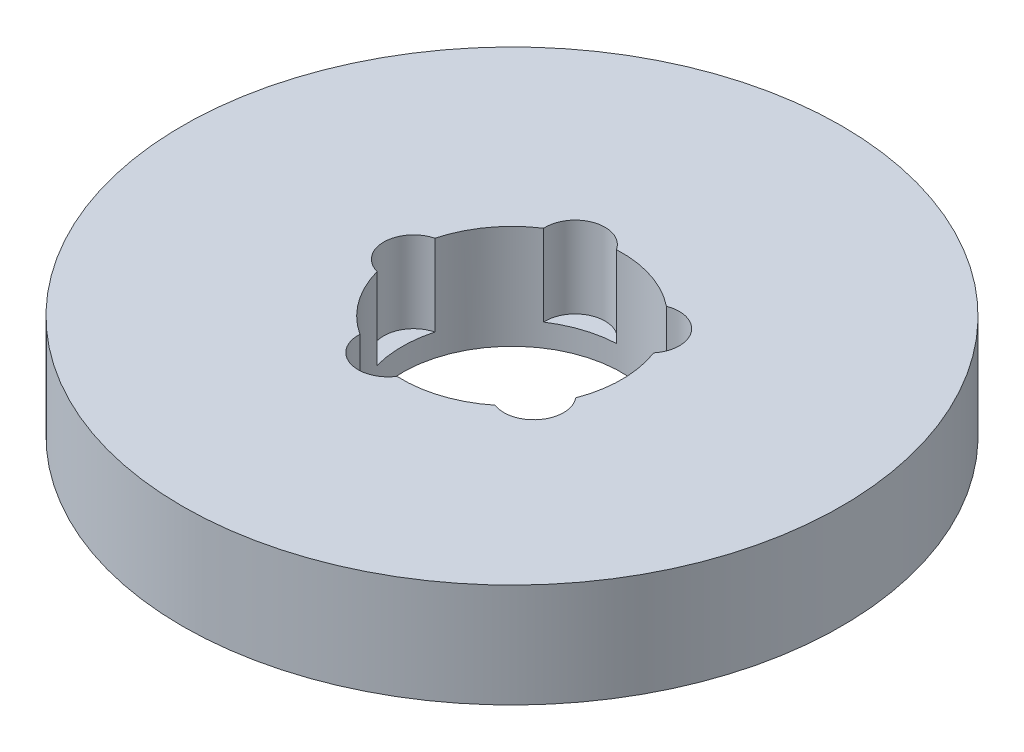
from build123d import *

# Parameters (mm, degrees)
SKETCH1_R           = 82.5
BOSS_EXTRUDE1_DEPTH = 26
SKETCH2_R           = 27.5
CUT_EXTRUDE1_DEPTH  = 120.534513844
SKETCH3_R           = 7.474537212
CUT_EXTRUDE2_DEPTH  = 20.34675524
CIRPATTERN1_COUNT   = 5


with BuildPart() as part:
    # Sketch1 → Boss-Extrude1 (new body)
    with BuildSketch(Plane(origin=(0, 0, 0), x_dir=(1, 0, 0), z_dir=(0, 1, 0))):
        Circle(SKETCH1_R)
    extrude(amount=BOSS_EXTRUDE1_DEPTH)

    # Sketch2 → Cut-Extrude1 (cut, through all)
    with BuildSketch(Plane(origin=(0, 0, 0), x_dir=(1, 0, 0), z_dir=(0, 1, 0))):
        Circle(SKETCH2_R)
    extrude(amount=CUT_EXTRUDE1_DEPTH, mode=Mode.SUBTRACT)

    # Sketch3 → Cut-Extrude2 (cut)
    with BuildSketch(Plane(origin=(0, 26, 0), x_dir=(1, 0, 0), z_dir=(0, 1, 0))):
        with Locations((-24.634517283, 0)):
            Circle(SKETCH3_R)
    cut_extrude2 = extrude(amount=-CUT_EXTRUDE2_DEPTH, mode=Mode.SUBTRACT)

    # CirPattern1: Cut-Extrude2 ×5 about axis
    cirpattern1_axis = Axis((0, 0, 0), (0, 1, 0))
    for i in range(1, CIRPATTERN1_COUNT):
        add(cut_extrude2.rotate(cirpattern1_axis, i * 360 / CIRPATTERN1_COUNT), mode=Mode.SUBTRACT)


solid = part.part
